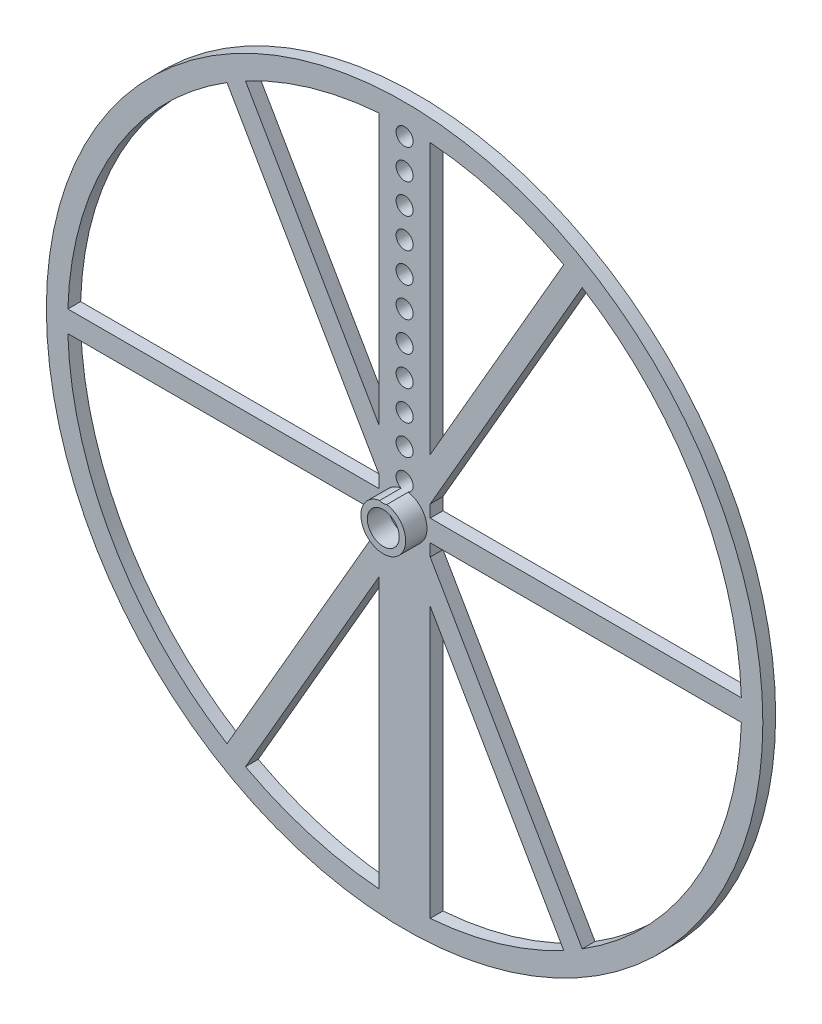
from build123d import *

# Parameters (mm, degrees)
SKETCH2_R               = 84
BOSS_EXTRUDE1_DEPTH     = 3
SKETCH3_R               = 2
CUT_EXTRUDE1_DEPTH      = 3
SKETCH5_W               = 73
SKETCH5_H               = 5
BOSS_EXTRUDE2_DEPTH     = 3
SKETCH6_R               = 2
CUT_EXTRUDE2_DEPTH      = 226.621039578
SKETCH12_W              = 4
SKETCH12_H              = 6
CUT_EXTRUDE3_DEPTH      = 3
FILLET1_R               = 1
BOSS_EXTRUDE3_OUTLINE_R = 3.75
BOSS_EXTRUDE3_DEPTH     = 5
SKETCH16_R              = 2
CUT_EXTRUDE4_DEPTH      = 15.2
CUT_EXTRUDE5_START      = -2
CUT_EXTRUDE5_DEPTH      = 2


# Read off the part's stored shape, not the designer's step: Boss-Extrude3
with BuildPart() as part:
    # Sketch2 → Boss-Extrude1 (new body)
    with BuildSketch(Plane.XY.offset(1)):
        with Locations((3.652326605, 123.87718283)):
            Circle(SKETCH2_R)
    extrude(amount=BOSS_EXTRUDE1_DEPTH)

    # Sketch3 → Cut-Extrude1 (cut)
    with BuildSketch(Plane.XY.offset(4)):
        with BuildLine():
            Line((-2.347673395, 45.105360456), (-2.347673395, 202.649005203))
            ThreePointArc((-2.347673395, 202.649005203), (-75.347673395, 123.87718283), (-2.347673395, 45.105360456))
        make_face()
        with BuildLine():
            Line((9.652326605, 202.649005203), (9.652326605, 45.105360456))
            ThreePointArc((9.652326605, 45.105360456), (61.596265028, 70.178951946), (82.652326605, 123.87718283))
            ThreePointArc((82.652326605, 123.87718283), (61.596265028, 177.575413713), (9.652326605, 202.649005203))
        make_face()
        with Locations((3.652326605, 200.87718283)):
            Circle(SKETCH3_R)
        with Locations((3.652326605, 193.87718283)):
            Circle(SKETCH3_R)
        with Locations((3.652326605, 186.87718283)):
            Circle(SKETCH3_R)
        with Locations((3.652326605, 179.87718283)):
            Circle(SKETCH3_R)
        with Locations((3.652326605, 172.87718283)):
            Circle(SKETCH3_R)
        with Locations((3.652326605, 165.87718283)):
            Circle(SKETCH3_R)
        with Locations((3.652326605, 158.87718283)):
            Circle(SKETCH3_R)
        with Locations((3.652326605, 151.87718283)):
            Circle(SKETCH3_R)
        with Locations((3.652326605, 144.87718283)):
            Circle(SKETCH3_R)
        with Locations((3.652326605, 123.87718283)):
            Circle(SKETCH3_R)
        with Locations((3.652326605, 130.87718283)):
            Circle(SKETCH3_R)
        with Locations((3.652326605, 137.87718283)):
            Circle(SKETCH3_R)
    extrude(amount=-CUT_EXTRUDE1_DEPTH, mode=Mode.SUBTRACT)

    # Sketch5 → Boss-Extrude2 (add)
    with BuildSketch(Plane.XY.offset(4)):
        with Locations((46.152326605, 123.87718283)):
            Rectangle(SKETCH5_W, SKETCH5_H)
        Polygon((4.487263096, 117.431030407), (8.817390114, 119.931030407), (45.317390114, 56.711175931), (40.987263096, 54.211175931), align=None)
        Polygon((-1.512736904, 119.931030407), (2.817390114, 117.431030407), (-33.682609886, 54.211175931), (-38.012736904, 56.711175931), align=None)
        with Locations((-38.847673395, 123.87718283)):
            Rectangle(SKETCH5_W, SKETCH5_H)
        Polygon((2.817390114, 130.323335252), (-1.512736904, 127.823335252), (-38.012736904, 191.043189729), (-33.682609886, 193.543189729), align=None)
        Polygon((8.817390114, 127.823335252), (4.487263096, 130.323335252), (40.987263096, 193.543189729), (45.317390114, 191.043189729), align=None)
    extrude(amount=-BOSS_EXTRUDE2_DEPTH)

    # Sketch6 → Cut-Extrude2 (cut, through all)
    with BuildSketch(Plane.XY.offset(4)):
        with Locations((3.652326605, 130.87718283)):
            Circle(SKETCH6_R)
    extrude(amount=-CUT_EXTRUDE2_DEPTH, mode=Mode.SUBTRACT)

    # Sketch12 → Cut-Extrude3 (cut)
    with BuildSketch(Plane.XY.offset(4)):
        with Locations((3.652326605, 123.87718283)):
            Rectangle(SKETCH12_W, SKETCH12_H)
    extrude(amount=-CUT_EXTRUDE3_DEPTH, mode=Mode.SUBTRACT)

    # Fillet1
    fillet1_edges = [part.edges().sort_by_distance(p)[0] for p in [
        (1.652326605, 120.87718283, 2.5),
        (5.652326605, 126.87718283, 2.5),
        (1.652326605, 126.87718283, 2.5),
        (5.652326605, 120.87718283, 2.5),
    ]]
    fillet(fillet1_edges, radius=FILLET1_R)

    # Boss-Extrude3 outline → Boss-Extrude3 (add)
    with BuildSketch(Plane.XY.offset(4)):
        with BuildLine():
            ThreePointArc((4.48817395, 129.060218544), (3.652326605, 128.87718283), (2.81647926, 129.060218544))
            ThreePointArc((2.81647926, 129.060218544), (3.652326605, 118.62718283), (4.48817395, 129.060218544))
        make_face()
        with Locations((3.652326605, 123.87718283)):
            Circle(BOSS_EXTRUDE3_OUTLINE_R, mode=Mode.SUBTRACT)
    extrude(amount=BOSS_EXTRUDE3_DEPTH)

    # Sketch16 → Cut-Extrude4 (cut)
    with BuildSketch(Plane.XY.offset(16.2)):
        with Locations((3.652326605, 123.87718283)):
            Circle(SKETCH16_R)
    extrude(amount=-CUT_EXTRUDE4_DEPTH, mode=Mode.SUBTRACT)

    # Sketch17 → Cut-Extrude5 (cut)
    with BuildSketch(Plane.XY.offset(16.2).offset(CUT_EXTRUDE5_START)):
        with BuildLine():
            ThreePointArc((2.652326605, 127.491390903), (1.000676176, 126.528833259), (0.038118531, 124.87718283))
            Line((0.038118531, 124.87718283), (1.920275797, 124.87718283))
            ThreePointArc((1.920275797, 124.87718283), (2.238113043, 125.291396392), (2.652326605, 125.609233637))
            Line((2.652326605, 125.609233637), (2.652326605, 127.491390903))
        make_face()
        with BuildLine():
            ThreePointArc((0.038118531, 122.87718283), (1.000676176, 121.2255324), (2.652326605, 120.262974756))
            Line((2.652326605, 120.262974756), (2.652326605, 122.145132022))
            ThreePointArc((2.652326605, 122.145132022), (2.238113043, 122.462969267), (1.920275797, 122.87718283))
            Line((1.920275797, 122.87718283), (0.038118531, 122.87718283))
        make_face()
        with BuildLine():
            Line((4.652326605, 122.145132022), (4.652326605, 120.262974756))
            ThreePointArc((4.652326605, 120.262974756), (6.303977034, 121.2255324), (7.266534679, 122.87718283))
            Line((7.266534679, 122.87718283), (5.384377413, 122.87718283))
            ThreePointArc((5.384377413, 122.87718283), (5.066540167, 122.462969267), (4.652326605, 122.145132022))
        make_face()
        with BuildLine():
            Line((5.384377413, 124.87718283), (7.266534679, 124.87718283))
            ThreePointArc((7.266534679, 124.87718283), (6.303977034, 126.528833259), (4.652326605, 127.491390903))
            Line((4.652326605, 127.491390903), (4.652326605, 125.609233637))
            ThreePointArc((4.652326605, 125.609233637), (5.066540167, 125.291396392), (5.384377413, 124.87718283))
        make_face()
    extrude(amount=CUT_EXTRUDE5_DEPTH, mode=Mode.SUBTRACT)


solid = part.part
